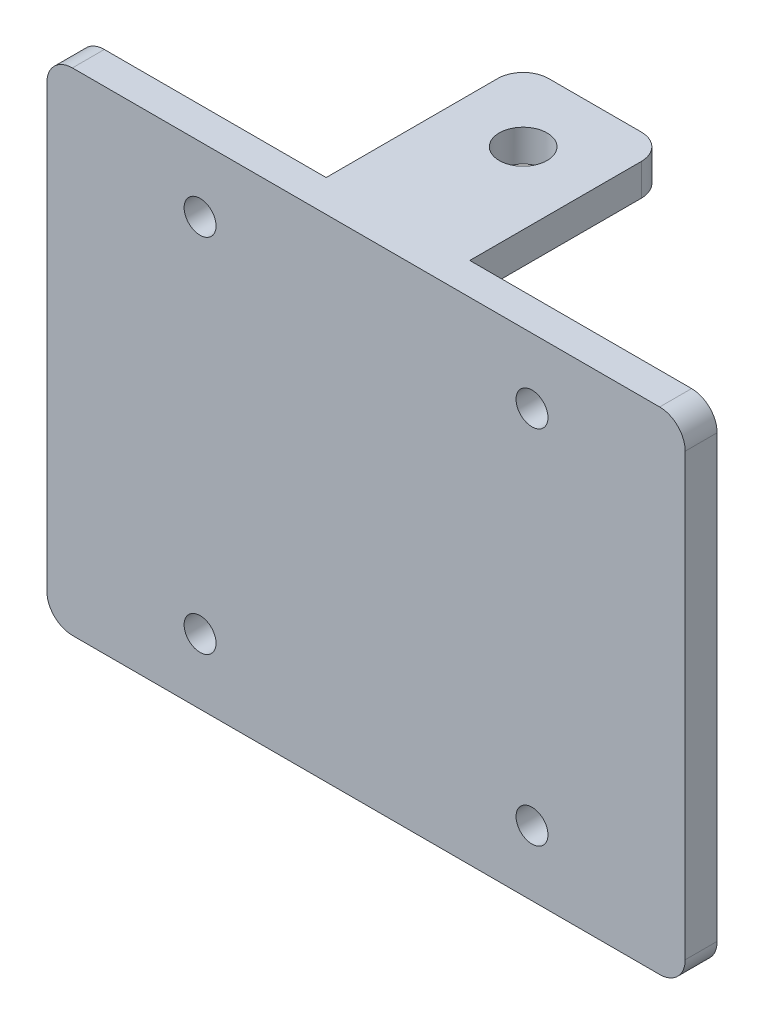
from build123d import *

# Parameters (mm, degrees)
SKETCH1_W           = 63.5
SKETCH1_H           = 48.895
BOSS_EXTRUDE1_DEPTH = 3.175
SKETCH6_W           = 14.2875
SKETCH6_H           = 19.598132
BOSS_EXTRUDE3_DEPTH = 3.175
CUT_EXTRUDE2_REACH  = 84.505
SKETCH7_R           = 2.38125
CUT_EXTRUDE1_REACH  = 85.316
SKETCH4_R           = 1.5875
FILLET1_R           = 2.54


with BuildPart() as part:
    # Sketch1 → Boss-Extrude1 (new body)
    with BuildSketch(Plane.XY):
        with Locations((31.75, 24.4475)):
            Rectangle(SKETCH1_W, SKETCH1_H)
    extrude(amount=BOSS_EXTRUDE1_DEPTH)

    # Sketch6 → Boss-Extrude3 (add)
    with BuildSketch(Plane(origin=(0, 48.895, 0), x_dir=(1, 0, 0), z_dir=(0, 1, 0))):
        with Locations((31.75, 9.799066)):
            Rectangle(SKETCH6_W, SKETCH6_H)
    extrude(amount=-BOSS_EXTRUDE3_DEPTH)

    # Sketch7 → Cut-Extrude2 (cut, up to next)
    with BuildSketch(Plane(origin=(0, 48.895, 0), x_dir=(1, 0, 0), z_dir=(0, 1, 0)), mode=Mode.PRIVATE) as cut_extrude2_sk1:
        with Locations((31.75, 12.454382)):
            Circle(SKETCH7_R)
    cut_extrude2_tool1 = extrude(cut_extrude2_sk1.sketch, amount=-CUT_EXTRUDE2_REACH, mode=Mode.PRIVATE) & part.part
    add(cut_extrude2_tool1.solids().sort_by_distance((31.75, 48.895, -12.454382))[0], mode=Mode.SUBTRACT)

    # Sketch4 → Cut-Extrude1 (cut, up to next)
    with BuildSketch(Plane.XY.offset(3.175), mode=Mode.PRIVATE) as cut_extrude1_sk1:
        with Locations((15.24, 6.477)):
            Circle(SKETCH4_R)
    cut_extrude1_tool1 = extrude(cut_extrude1_sk1.sketch, amount=-CUT_EXTRUDE1_REACH, mode=Mode.PRIVATE) & part.part
    # Sketch4 → Cut-Extrude1 (cut, up to next)
    with BuildSketch(Plane.XY.offset(3.175), mode=Mode.PRIVATE) as cut_extrude1_sk2:
        with Locations((15.24, 42.418)):
            Circle(SKETCH4_R)
    cut_extrude1_tool2 = extrude(cut_extrude1_sk2.sketch, amount=-CUT_EXTRUDE1_REACH, mode=Mode.PRIVATE) & part.part
    # Sketch4 → Cut-Extrude1 (cut, up to next)
    with BuildSketch(Plane.XY.offset(3.175), mode=Mode.PRIVATE) as cut_extrude1_sk3:
        with Locations((48.26, 42.418)):
            Circle(SKETCH4_R)
    cut_extrude1_tool3 = extrude(cut_extrude1_sk3.sketch, amount=-CUT_EXTRUDE1_REACH, mode=Mode.PRIVATE) & part.part
    # Sketch4 → Cut-Extrude1 (cut, up to next)
    with BuildSketch(Plane.XY.offset(3.175), mode=Mode.PRIVATE) as cut_extrude1_sk4:
        with Locations((48.26, 6.477)):
            Circle(SKETCH4_R)
    cut_extrude1_tool4 = extrude(cut_extrude1_sk4.sketch, amount=-CUT_EXTRUDE1_REACH, mode=Mode.PRIVATE) & part.part
    add(cut_extrude1_tool1.solids().sort_by_distance((15.24, 6.477, 3.175))[0], mode=Mode.SUBTRACT)
    add(cut_extrude1_tool2.solids().sort_by_distance((15.24, 42.418, 3.175))[0], mode=Mode.SUBTRACT)
    add(cut_extrude1_tool3.solids().sort_by_distance((48.26, 42.418, 3.175))[0], mode=Mode.SUBTRACT)
    add(cut_extrude1_tool4.solids().sort_by_distance((48.26, 6.477, 3.175))[0], mode=Mode.SUBTRACT)

    # Fillet1
    fillet1_edges = [part.edges().sort_by_distance(p)[0] for p in [
        (0, 0, 1.5875),
        (63.5, 0, 1.5875),
        (0, 48.895, 1.5875),
        (63.5, 48.895, 1.5875),
        (24.60625, 47.3075, -19.598132),
        (38.89375, 47.3075, -19.598132),
    ]]
    fillet(fillet1_edges, radius=FILLET1_R)


solid = part.part
